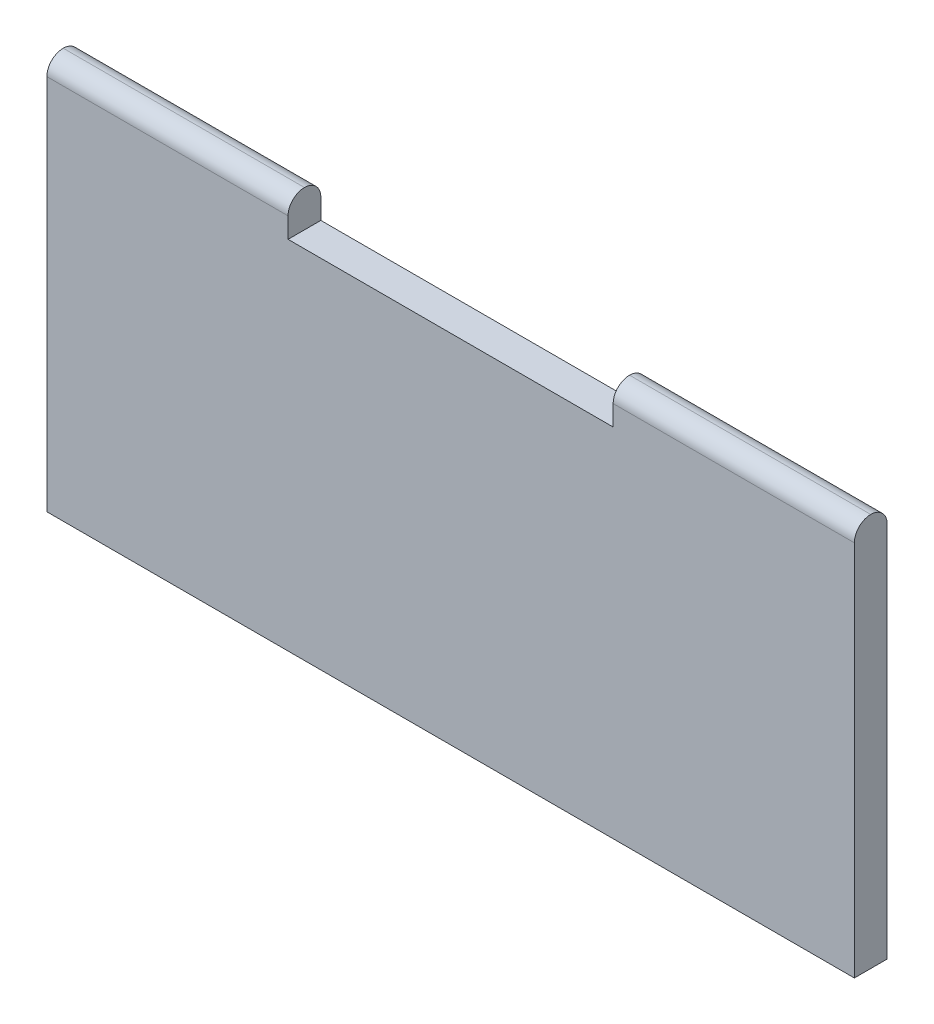
from build123d import *

# Parameters (mm, degrees)
SKETCH_1_W          = 308
SKETCH_1_H          = 150
EXTRUDE_1_DEPTH     = 12.5
FILLET_1_R          = 6.25
FILLET_2_R          = 6.25
CUT_EXTRUDE_1_DEPTH = 44


with BuildPart() as part:
    # 草图1 → 凸台-拉伸1 (new body)
    with BuildSketch(Plane.XY):
        with Locations((154, 75)):
            Rectangle(SKETCH_1_W, SKETCH_1_H)
    extrude(amount=EXTRUDE_1_DEPTH)

    # 圆角1
    fillet_1_edges = [part.edges().sort_by_distance(p)[0] for p in [
        (154, 150, 12.5),
    ]]
    fillet(fillet_1_edges, radius=FILLET_1_R)

    # 圆角2
    fillet_2_edges = [part.edges().sort_by_distance(p)[0] for p in [
        (154, 150, 0),
    ]]
    fillet(fillet_2_edges, radius=FILLET_2_R - 0.0001)  # a hair under: the kernel refuses the full size

    # 草图2 → 切除-拉伸1 (cut)
    with BuildSketch(Plane(origin=(0, 0, 0), x_dir=(-1, 0, 0), z_dir=(0, 0, -1))):
        Polygon((-154, 136), (-92, 136), (-92, 165.928579256), (-216, 165.928579256), (-216, 136), align=None)
    extrude(amount=-CUT_EXTRUDE_1_DEPTH, mode=Mode.SUBTRACT)


solid = part.part
